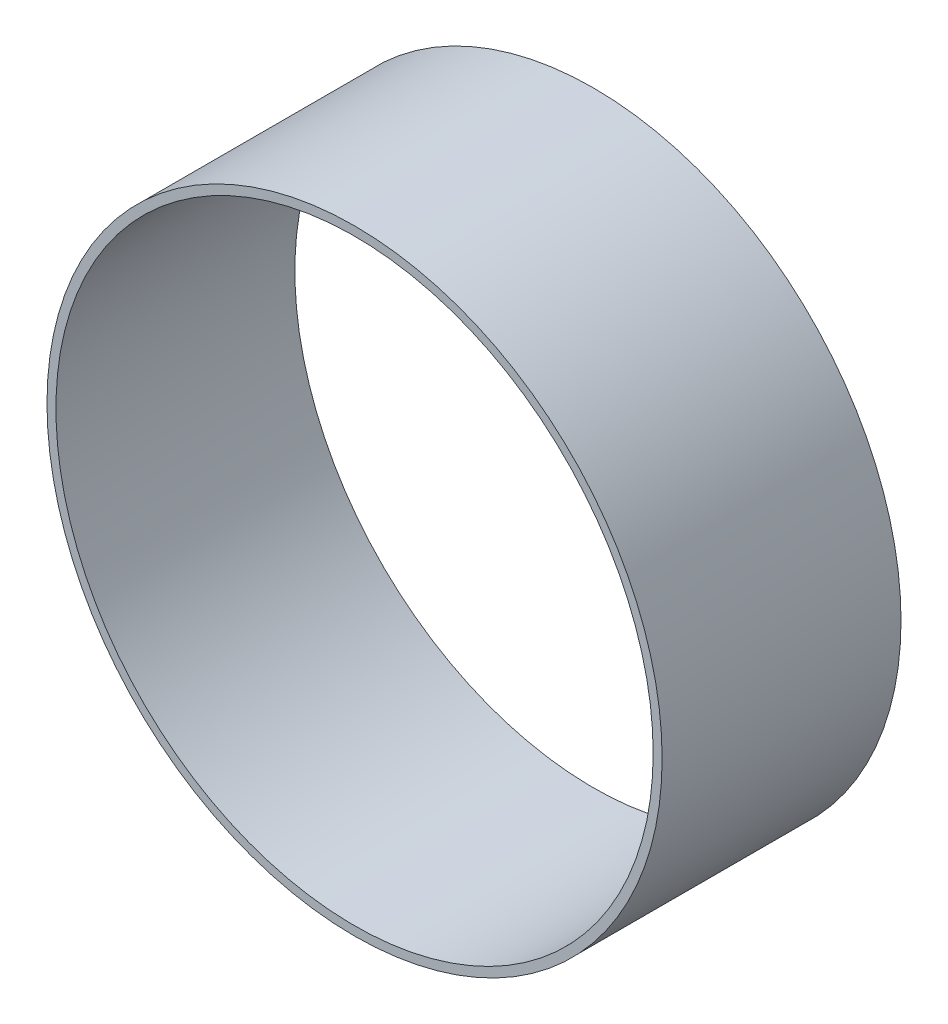
from build123d import *

# Parameters (mm, degrees)
SKETCH1_R           = 65.405
SKETCH1_R_2         = 63.5
BOSS_EXTRUDE1_DEPTH = 25.4


with BuildPart() as part:
    # Sketch1 → Boss-Extrude1 (new, symmetric)
    with BuildSketch(Plane.XY):
        Circle(SKETCH1_R)
        Circle(SKETCH1_R_2, mode=Mode.SUBTRACT)
    extrude(amount=BOSS_EXTRUDE1_DEPTH, both=True)


solid = part.part
